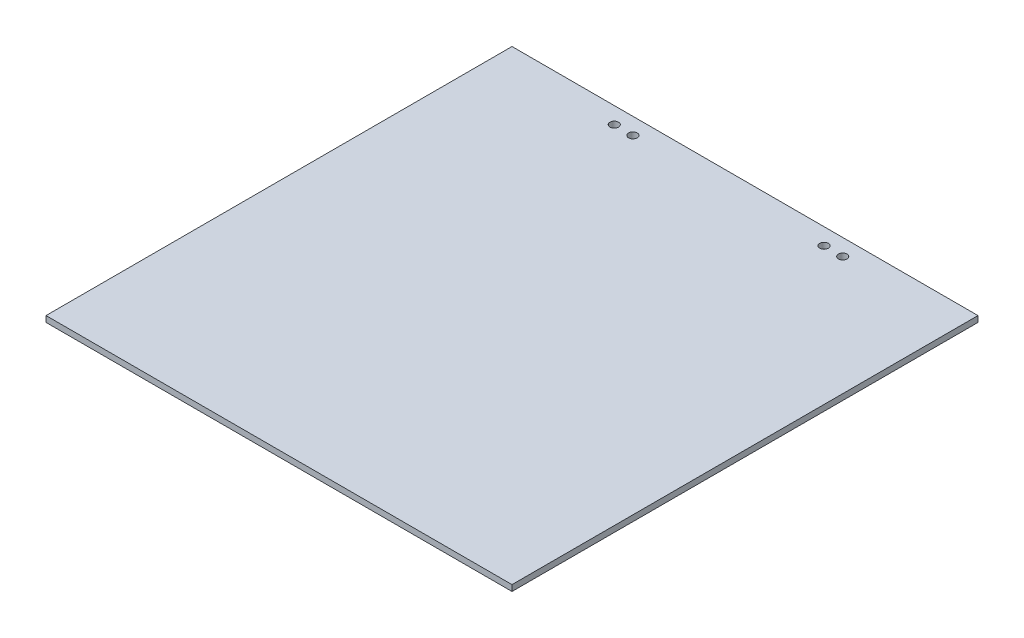
from build123d import *

# Parameters (mm, degrees)
SKETCH1_W           = 247.65
SKETCH1_H           = 247.65
BOSS_EXTRUDE1_DEPTH = 3.175
SKETCH2_R           = 2.286
CUT_EXTRUDE1_DEPTH  = 351.244379862


with BuildPart() as part:
    # Sketch1 → Boss-Extrude1 (new body)
    with BuildSketch(Plane(origin=(0, 0, 0), x_dir=(1, 0, 0), z_dir=(0, 1, 0))):
        with Locations((123.825, 123.825)):
            Rectangle(SKETCH1_W, SKETCH1_H)
    extrude(amount=BOSS_EXTRUDE1_DEPTH)

    # Sketch2 → Cut-Extrude1 (cut, through all)
    with BuildSketch(Plane(origin=(0, 3.175, 0), x_dir=(1, 0, 0), z_dir=(0, 1, 0))):
        with Locations((63.119, 238.8616)):
            Circle(SKETCH2_R)
        with Locations((73.025, 238.8616)):
            Circle(SKETCH2_R)
        with Locations((174.625, 238.8616)):
            Circle(SKETCH2_R)
        with Locations((184.531, 238.8616)):
            Circle(SKETCH2_R)
    extrude(amount=-CUT_EXTRUDE1_DEPTH, mode=Mode.SUBTRACT)


solid = part.part
